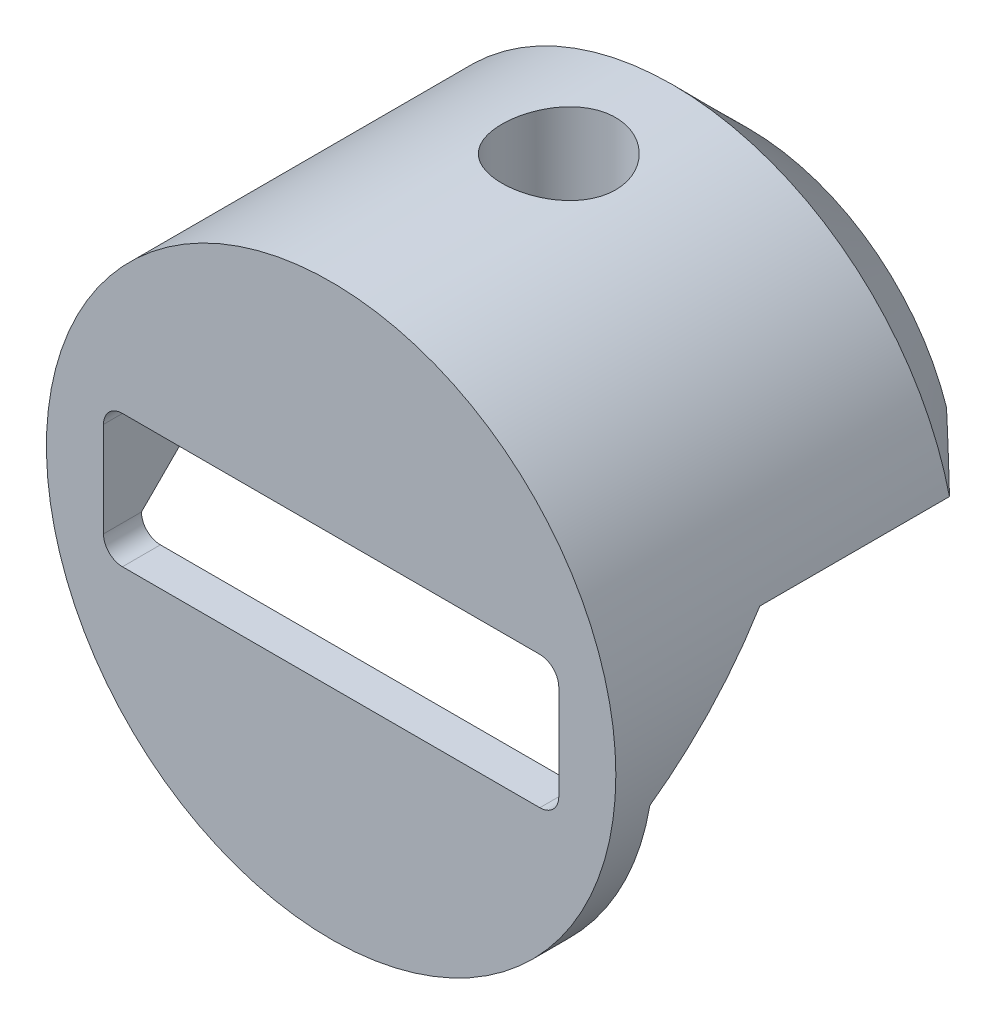
from build123d import *
from build123d.topology import SkipClean

# Parameters (mm, degrees)
SKETCH1_R                                           = 23.8252
BOSS_EXTRUDE1_DEPTH                                 = 3.175
SKETCH8_W                                           = 38.1
SKETCH8_H                                           = 11.1125
CUT_EXTRUDE1_DEPTH                                  = 34.843181515
FILLET1_R                                           = 1.5875
BOSS_EXTRUDE2_START                                 = 31.75
BOSS_EXTRUDE2_DEPTH                                 = 31.75
CHAMFER1_START                                      = -23.8252001
CHAMFER1_DEPTH                                      = 6.3627001
CHAMFER1_START_2                                    = 17.4625
CHAMFER1_2_DEPTH                                    = 6.3627
CHAMFER1_START_3                                    = -31.7500001
CHAMFER1_3_DEPTH                                    = 31.7500001
CBORE_FOR_8_BINDING_HEAD_MACHINE_SCREW1_D           = 4.4958
CBORE_FOR_8_BINDING_HEAD_MACHINE_SCREW1_CBORE_D     = 9.525
CBORE_FOR_8_BINDING_HEAD_MACHINE_SCREW1_CBORE_DEPTH = 15.367
CHAMFER3_SIZE                                       = 6.35


with BuildPart() as part:
    # Sketch1 → Boss-Extrude1 (new body)
    with BuildSketch(Plane.XY):
        Circle(SKETCH1_R)
    extrude(amount=BOSS_EXTRUDE1_DEPTH)

    # Sketch8 → Cut-Extrude1 (cut, through all)
    with BuildSketch(Plane.XY.offset(3.175)):
        Rectangle(SKETCH8_W, SKETCH8_H)
    extrude(amount=-CUT_EXTRUDE1_DEPTH, mode=Mode.SUBTRACT)

    # Fillet1
    fillet1_edges = [part.edges().sort_by_distance(p)[0] for p in [
        (19.05, -5.55625, 1.5875),
        (-19.05, -5.55625, 1.5875),
        (-19.05, 5.55625, 1.5875),
        (19.05, 5.55625, 1.5875),
    ]]
    fillet(fillet1_edges, radius=FILLET1_R)

    # Sketch9 → Boss-Extrude2 (add)
    with SkipClean():  # the faces are left unmerged after this step: merging them gives an invalid solid
        with BuildSketch(Plane(origin=(0, 0, 0), x_dir=(-1, 0, 0), z_dir=(0, 0, -1)).offset(BOSS_EXTRUDE2_START)):
            with BuildLine():
                Line((-23.168259343, 5.55625), (23.168259343, 5.55625))
                ThreePointArc((23.168259343, 5.55625), (0, 23.8252), (-23.168259343, 5.55625))
            make_face()
        extrude(amount=-BOSS_EXTRUDE2_DEPTH)

    # Chamfer1: read off the stored shape, not the designer's step
    # Chamfer1 outline → Chamfer1 (add)
    with SkipClean():  # the faces are left unmerged after this step: merging them gives an invalid solid
        with BuildSketch(Plane.YZ.offset(CHAMFER1_START)):
            Polygon((5.55625, 0), (-3.96875, 0), (5.55625, -9.525), align=None)
        extrude(amount=CHAMFER1_DEPTH)

    # Chamfer1 2 outline → Chamfer1 2 (add)
    with SkipClean():  # the faces are left unmerged after this step: merging them gives an invalid solid
        with BuildSketch(Plane.YZ.offset(CHAMFER1_START_2)):
            Polygon((5.55625, 0), (-3.96875, 0), (5.55625, -9.525), align=None)
        extrude(amount=CHAMFER1_2_DEPTH)

    # Chamfer1 3 outline → Chamfer1 3 (cut)
    with BuildSketch(Plane.XY.offset(CHAMFER1_START_3)):
        with BuildLine():
            Line((23.8252, -5), (23.8252, 0))
            ThreePointArc((23.8252, 0), (23.692188185, -2.514035408), (23.294637903, -5))
            Line((23.294637903, -5), (23.8252, -5))
        make_face()
        with BuildLine():
            ThreePointArc((23.168259343, 5.55625), (23.660394835, 2.797475875), (23.8252, 0))
            Line((23.8252, 0), (23.8252, 5.55625))
            Line((23.8252, 5.55625), (23.168259343, 5.55625))
        make_face()
        with BuildLine():
            ThreePointArc((19.05, 3.96875), (18.585032015, 5.091282015), (17.4625, 5.55625))
            Line((17.4625, 5.55625), (17.4625, -5))
            Line((17.4625, -5), (19.05, -5))
            Line((19.05, -5), (19.05, 3.96875))
        make_face()
        with BuildLine():
            Line((-23.8252001, -5), (-23.294637903, -5))
            ThreePointArc((-23.294637903, -5), (-23.692188185, -2.514035408), (-23.8252, 0))
            Line((-23.8252, 0), (-23.8252001, -5))
        make_face()
        with BuildLine():
            Line((-17.4625, -5), (-17.4625, 5.55625))
            ThreePointArc((-17.4625, 5.55625), (-18.585032015, 5.091282015), (-19.05, 3.96875))
            Line((-19.05, 3.96875), (-19.05, -5))
            Line((-19.05, -5), (-17.4625, -5))
        make_face()
        with BuildLine():
            Line((-23.8252001, 5.55625), (-23.8252, 0))
            ThreePointArc((-23.8252, 0), (-23.660394835, 2.797475875), (-23.168259343, 5.55625))
            Line((-23.168259343, 5.55625), (-23.8252001, 5.55625))
        make_face()
    extrude(amount=CHAMFER1_3_DEPTH, mode=Mode.SUBTRACT)

    # CBORE for #8 Binding Head Machine Screw1 (through all)
    with Locations(Plane(origin=(0, 23.8252, 0), x_dir=(1, 0, 0), z_dir=(0, 1, 0))):
        with Locations((0, 15.875)):
            CounterBoreHole(CBORE_FOR_8_BINDING_HEAD_MACHINE_SCREW1_D / 2, CBORE_FOR_8_BINDING_HEAD_MACHINE_SCREW1_CBORE_D / 2, CBORE_FOR_8_BINDING_HEAD_MACHINE_SCREW1_CBORE_DEPTH)

    # Chamfer3
    chamfer3_edges = [part.edges().sort_by_distance(p)[0] for p in [
        (0, 23.8252, -31.75),
    ]]
    chamfer(chamfer3_edges, length=CHAMFER3_SIZE)


solid = part.part
